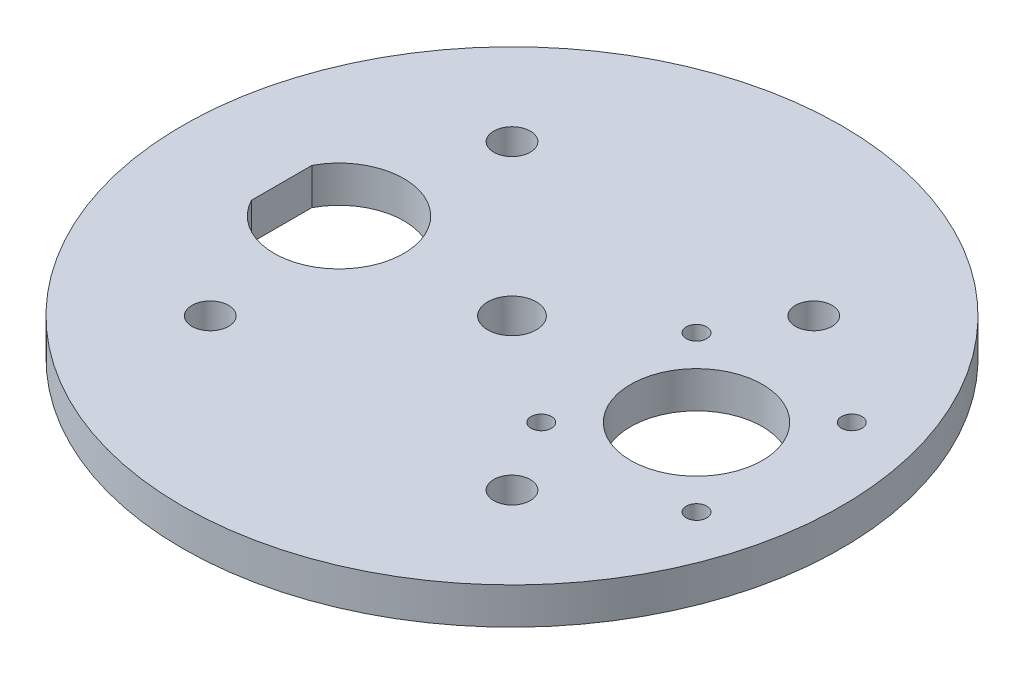
from build123d import *

# Parameters (mm, degrees)
SKETCH2_R           = 57.15
BOSS_EXTRUDE1_DEPTH = 6.35
CUT_EXTRUDE1_REACH  = 83.071
SKETCH6_R           = 3.175
SKETCH7_R           = 11.43
SKETCH7_R_2         = 1.778
CUT_EXTRUDE2_DEPTH  = 82.071372876
SKETCH8_R           = 4.2164
CUT_EXTRUDE3_DEPTH  = 82.071372876


with BuildPart() as part:
    # Sketch2 → Boss-Extrude1 (new body)
    with BuildSketch(Plane(origin=(0, 0, 0), x_dir=(1, 0, 0), z_dir=(0, 1, 0))):
        Circle(SKETCH2_R)
    extrude(amount=BOSS_EXTRUDE1_DEPTH)

    # Sketch6 → Cut-Extrude1 (cut, up to next)
    with BuildSketch(Plane(origin=(0, 6.35, 0), x_dir=(1, 0, 0), z_dir=(0, 1, 0)), mode=Mode.PRIVATE) as cut_extrude1_sk1:
        with Locations((-26.1629, -26.1629)):
            Circle(SKETCH6_R)
    cut_extrude1_tool1 = extrude(cut_extrude1_sk1.sketch, amount=-CUT_EXTRUDE1_REACH, mode=Mode.PRIVATE) & part.part
    # Sketch6 → Cut-Extrude1 (cut, up to next)
    with BuildSketch(Plane(origin=(0, 6.35, 0), x_dir=(1, 0, 0), z_dir=(0, 1, 0)), mode=Mode.PRIVATE) as cut_extrude1_sk2:
        with Locations((26.1629, -26.1629)):
            Circle(SKETCH6_R)
    cut_extrude1_tool2 = extrude(cut_extrude1_sk2.sketch, amount=-CUT_EXTRUDE1_REACH, mode=Mode.PRIVATE) & part.part
    # Sketch6 → Cut-Extrude1 (cut, up to next)
    with BuildSketch(Plane(origin=(0, 6.35, 0), x_dir=(1, 0, 0), z_dir=(0, 1, 0)), mode=Mode.PRIVATE) as cut_extrude1_sk3:
        with Locations((-26.1629, 26.163103615)):
            Circle(SKETCH6_R)
    cut_extrude1_tool3 = extrude(cut_extrude1_sk3.sketch, amount=-CUT_EXTRUDE1_REACH, mode=Mode.PRIVATE) & part.part
    # Sketch6 → Cut-Extrude1 (cut, up to next)
    with BuildSketch(Plane(origin=(0, 6.35, 0), x_dir=(1, 0, 0), z_dir=(0, 1, 0)), mode=Mode.PRIVATE) as cut_extrude1_sk4:
        with Locations((26.1629, 26.163103615)):
            Circle(SKETCH6_R)
    cut_extrude1_tool4 = extrude(cut_extrude1_sk4.sketch, amount=-CUT_EXTRUDE1_REACH, mode=Mode.PRIVATE) & part.part
    add(cut_extrude1_tool1.solids().sort_by_distance((-26.1629, 6.35, 26.1629))[0], mode=Mode.SUBTRACT)
    add(cut_extrude1_tool2.solids().sort_by_distance((26.1629, 6.35, 26.1629))[0], mode=Mode.SUBTRACT)
    add(cut_extrude1_tool3.solids().sort_by_distance((-26.1629, 6.35, -26.163104))[0], mode=Mode.SUBTRACT)
    add(cut_extrude1_tool4.solids().sort_by_distance((26.1629, 6.35, -26.163104))[0], mode=Mode.SUBTRACT)

    # Sketch7 → Cut-Extrude2 (cut, through all)
    with BuildSketch(Plane(origin=(0, 6.35, 0), x_dir=(1, 0, 0), z_dir=(0, 1, 0))):
        with Locations((32, 0)):
            Circle(SKETCH7_R)
        with Locations((18.54, -13.464)):
            Circle(SKETCH7_R_2)
        with Locations((18.54, 13.46)):
            Circle(SKETCH7_R_2)
        with Locations((45.46, 13.46)):
            Circle(SKETCH7_R_2)
        with Locations((45.46, -13.464)):
            Circle(SKETCH7_R_2)
    extrude(amount=-CUT_EXTRUDE2_DEPTH, mode=Mode.SUBTRACT)

    # Sketch8 → Cut-Extrude3 (cut, through all)
    with BuildSketch(Plane(origin=(0, 6.35, 0), x_dir=(1, 0, 0), z_dir=(0, 1, 0))):
        Circle(SKETCH8_R)
        with BuildLine():
            Line((-39.95, 5.249761899), (-39.95, -5.249761899))
            ThreePointArc((-39.95, -5.249761899), (-18.75, 0), (-39.95, 5.249761899))
        make_face()
    extrude(amount=-CUT_EXTRUDE3_DEPTH, mode=Mode.SUBTRACT)


solid = part.part
